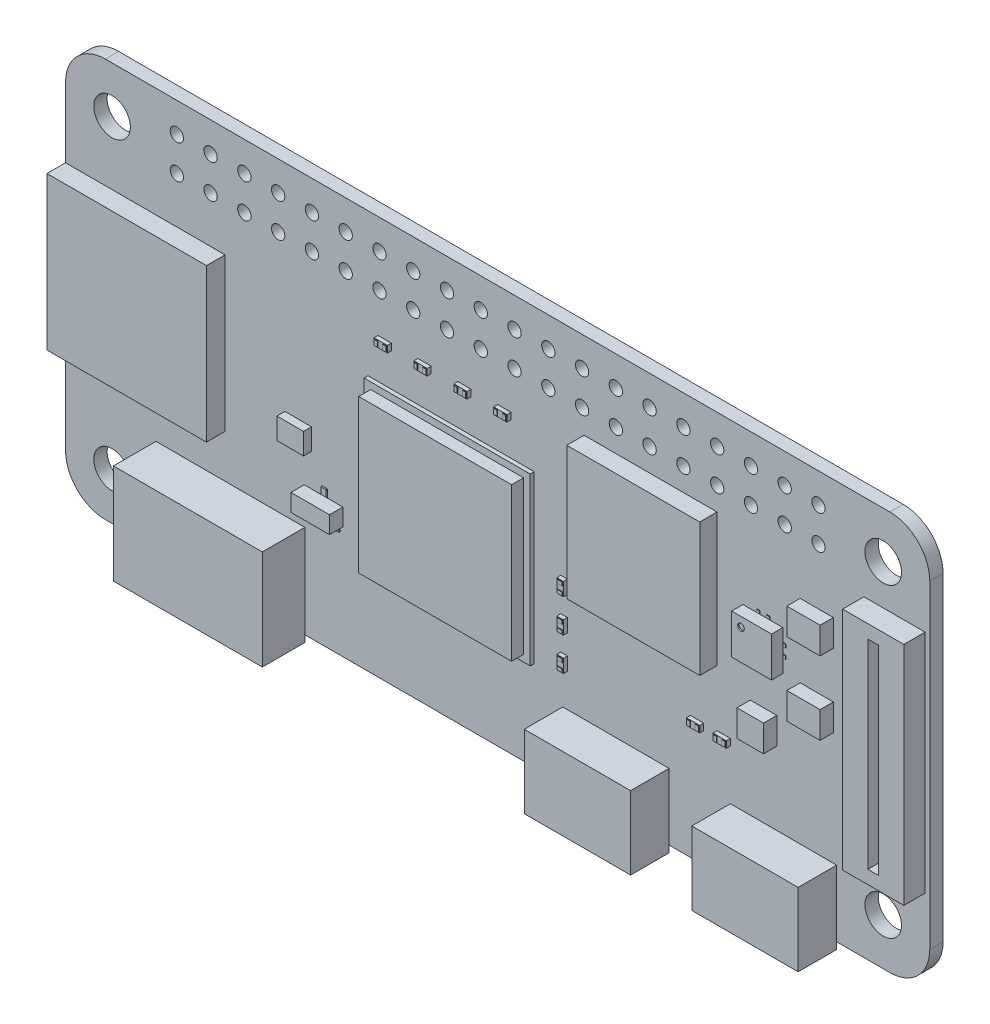
from build123d import *

# Parameters (mm, degrees)
PCB_DEPTH       = 1
SKETCH2_W       = 0.25
SKETCH2_H       = 0.3
SKETCH2_W_2     = 0.3
SKETCH2_H_2     = 0.25
SMD_ADD00_DEPTH = 0.05
SKETCH3_W       = 0.4
SKETCH3_H       = 0.7
SMD_ADD01_DEPTH = 0.1
SKETCH4_W       = 12.5
SKETCH4_H       = 12.5
SKETCH4_W_2     = 0.5
SKETCH4_H_2     = 1
SKETCH4_W_3     = 1
SKETCH4_H_3     = 0.5
SMD_ADD02_DEPTH = 0.3
SKETCH5_W       = 2
SKETCH5_H       = 1.6
SMD_ADD03_DEPTH = 0.6
SKETCH6_W       = 2.5
SKETCH6_H       = 2
SKETCH6_W_2     = 2
SMD_ADD04_DEPTH = 1
SKETCH7_W       = 10
SKETCH7_H       = 10
SMD_ADD05_DEPTH = 1.3
SKETCH8_W       = 12
SKETCH8_H       = 11.5
SMD_ADD06_DEPTH = 1.4
SKETCH9_W       = 4.6
SKETCH9_H       = 17
SMD_ADD07_DEPTH = 1.6
SKETCH10_W      = 8
SKETCH10_H      = 5.5
SMD_ADD08_DEPTH = 2.9
SKETCH11_W      = 11.2
SKETCH11_H      = 7.5
SMD_ADD09_DEPTH = 3.2
SKETCH12_W      = 3
SKETCH12_H      = 3
SMD_ADD10_DEPTH = 0.85
SKETCH13_W      = 2.9
SKETCH13_H      = 1.3
SMD_ADD11_DEPTH = 1
SKETCH14_W      = 0.4
SKETCH14_H      = 0.25
SKETCH14_W_2    = 0.25
SKETCH14_H_2    = 0.4
SMD_ADD12_DEPTH = 0.05
SKETCH15_W      = 11.5
SKETCH15_H      = 11.5
SMD_ADD13_DEPTH = 0.9
SKETCH16_W      = 5.5
SKETCH16_H      = 2
SMD_CUT00_DEPTH = 7
SKETCH17_R      = 0.25
SMD_CUT01_DEPTH = 0.1
SKETCH18_W      = 0.8
SKETCH18_H      = 15
SMD_CUT02_DEPTH = 1.1
SKETCH19_R      = 1.375
SKETCH19_R_2    = 0.5
HOLES_DEPTH     = 1


with BuildPart() as part:
    # Sketch1 → PCB (new body)
    with BuildSketch(Plane.XY):
        with BuildLine():
            Line((3, 0), (62, 0))
            ThreePointArc((62, 0), (64.121320344, 0.878679656), (65, 3))
            Line((65, 3), (65, 27))
            ThreePointArc((65, 27), (64.121320344, 29.121320344), (62, 30))
            Line((62, 30), (3, 30))
            ThreePointArc((3, 30), (0.878679656, 29.121320344), (0, 27))
            Line((0, 27), (0, 3))
            ThreePointArc((0, 3), (0.878679656, 0.878679656), (3, 0))
        make_face()
    extrude(amount=PCB_DEPTH)

    # Sketch2 → SMD_add00 (add)
    with BuildSketch(Plane.XY.offset(1)):
        with Locations((52.125, 15.45)):
            Rectangle(SKETCH2_W, SKETCH2_H)
        with Locations((50.95, 16.625)):
            Rectangle(SKETCH2_W_2, SKETCH2_H_2)
        with Locations((52.125, 18.55)):
            Rectangle(SKETCH2_W, SKETCH2_H)
        with Locations((54.05, 16.625)):
            Rectangle(SKETCH2_W_2, SKETCH2_H_2)
        with Locations((52.875, 15.45)):
            Rectangle(SKETCH2_W, SKETCH2_H)
        with Locations((50.95, 17.375)):
            Rectangle(SKETCH2_W_2, SKETCH2_H_2)
        with Locations((52.875, 18.55)):
            Rectangle(SKETCH2_W, SKETCH2_H)
        with Locations((54.05, 17.375)):
            Rectangle(SKETCH2_W_2, SKETCH2_H_2)
    extrude(amount=SMD_ADD00_DEPTH)

    # Sketch3 → SMD_add01 (add)
    with BuildSketch(Plane.XY.offset(1)):
        with Locations((18.55, 8.4)):
            Rectangle(SKETCH3_W, SKETCH3_H)
        with Locations((20.45, 8.4)):
            Rectangle(SKETCH3_W, SKETCH3_H)
        with Locations((19.5, 10)):
            Rectangle(SKETCH3_W, SKETCH3_H)
    extrude(amount=SMD_ADD01_DEPTH)

    # Sketch4 → SMD_add02 (add)
    with BuildSketch(Plane.XY.offset(1)):
        with Locations((29, 13)):
            Rectangle(SKETCH4_W, SKETCH4_H)
        with Locations((37.5, 8)):
            Rectangle(SKETCH4_W_2, SKETCH4_H_2)
        with Locations((37.5, 10.5)):
            Rectangle(SKETCH4_W_2, SKETCH4_H_2)
        with Locations((37.5, 13)):
            Rectangle(SKETCH4_W_2, SKETCH4_H_2)
        with Locations((47.5, 9)):
            Rectangle(SKETCH4_W_3, SKETCH4_H_3)
        with Locations((49.5, 9)):
            Rectangle(SKETCH4_W_3, SKETCH4_H_3)
        with Locations((24, 22)):
            Rectangle(SKETCH4_W_3, SKETCH4_H_3)
        with Locations((27, 22)):
            Rectangle(SKETCH4_W_3, SKETCH4_H_3)
        with Locations((30, 22)):
            Rectangle(SKETCH4_W_3, SKETCH4_H_3)
        with Locations((33, 22)):
            Rectangle(SKETCH4_W_3, SKETCH4_H_3)
    extrude(amount=SMD_ADD02_DEPTH)

    # Sketch5 → SMD_add03 (add)
    with BuildSketch(Plane.XY.offset(1)):
        with Locations((17.5, 13)):
            Rectangle(SKETCH5_W, SKETCH5_H)
    extrude(amount=SMD_ADD03_DEPTH)

    # Sketch6 → SMD_add04 (add)
    with BuildSketch(Plane.XY.offset(1)):
        with Locations((56.5, 20)):
            Rectangle(SKETCH6_W, SKETCH6_H)
        with Locations((56.5, 14.5)):
            Rectangle(SKETCH6_W, SKETCH6_H)
        with Locations((52.5, 11.5)):
            Rectangle(SKETCH6_W_2, SKETCH6_H)
    extrude(amount=SMD_ADD04_DEPTH)

    # Sketch7 → SMD_add05 (add)
    with BuildSketch(Plane.XY.offset(1)):
        with Locations((44, 18.5)):
            Rectangle(SKETCH7_W, SKETCH7_H)
    extrude(amount=SMD_ADD05_DEPTH)

    # Sketch8 → SMD_add06 (add)
    with BuildSketch(Plane.XY.offset(1)):
        with Locations((6, 16)):
            Rectangle(SKETCH8_W, SKETCH8_H)
    extrude(amount=SMD_ADD06_DEPTH)

    # Sketch9 → SMD_add07 (add)
    with BuildSketch(Plane.XY.offset(1)):
        with Locations((62.35, 15)):
            Rectangle(SKETCH9_W, SKETCH9_H)
    extrude(amount=SMD_ADD07_DEPTH)

    # Sketch10 → SMD_add08 (add)
    with BuildSketch(Plane.XY.offset(1)):
        with Locations((41.4, 2.25)):
            Rectangle(SKETCH10_W, SKETCH10_H)
        with Locations((54, 2.25)):
            Rectangle(SKETCH10_W, SKETCH10_H)
    extrude(amount=SMD_ADD08_DEPTH)

    # Sketch11 → SMD_add09 (add)
    with BuildSketch(Plane.XY.offset(1)):
        with Locations((12.4, 3.25)):
            Rectangle(SKETCH11_W, SKETCH11_H)
    extrude(amount=SMD_ADD09_DEPTH)

    # Sketch12 → SMD_add10 (add)
    with BuildSketch(Plane.XY.offset(1.05)):
        with Locations((52.5, 17)):
            Rectangle(SKETCH12_W, SKETCH12_H)
    extrude(amount=SMD_ADD10_DEPTH)

    # Sketch13 → SMD_add11 (add)
    with BuildSketch(Plane.XY.offset(1.1)):
        with Locations((19.5, 9.2)):
            Rectangle(SKETCH13_W, SKETCH13_H)
    extrude(amount=SMD_ADD11_DEPTH)

    # Sketch14 → SMD_add12 (add)
    with BuildSketch(Plane.XY.offset(1.3)):
        with Locations((37.5, 7.675)):
            Rectangle(SKETCH14_W, SKETCH14_H)
        with Locations((37.5, 8.325)):
            Rectangle(SKETCH14_W, SKETCH14_H)
        with Locations((37.5, 10.175)):
            Rectangle(SKETCH14_W, SKETCH14_H)
        with Locations((37.5, 10.825)):
            Rectangle(SKETCH14_W, SKETCH14_H)
        with Locations((37.5, 12.675)):
            Rectangle(SKETCH14_W, SKETCH14_H)
        with Locations((37.5, 13.325)):
            Rectangle(SKETCH14_W, SKETCH14_H)
        with Locations((47.175, 9)):
            Rectangle(SKETCH14_W_2, SKETCH14_H_2)
        with Locations((47.825, 9)):
            Rectangle(SKETCH14_W_2, SKETCH14_H_2)
        with Locations((49.175, 9)):
            Rectangle(SKETCH14_W_2, SKETCH14_H_2)
        with Locations((49.825, 9)):
            Rectangle(SKETCH14_W_2, SKETCH14_H_2)
        with Locations((23.675, 22)):
            Rectangle(SKETCH14_W_2, SKETCH14_H_2)
        with Locations((24.325, 22)):
            Rectangle(SKETCH14_W_2, SKETCH14_H_2)
        with Locations((26.675, 22)):
            Rectangle(SKETCH14_W_2, SKETCH14_H_2)
        with Locations((27.325, 22)):
            Rectangle(SKETCH14_W_2, SKETCH14_H_2)
        with Locations((29.675, 22)):
            Rectangle(SKETCH14_W_2, SKETCH14_H_2)
        with Locations((30.325, 22)):
            Rectangle(SKETCH14_W_2, SKETCH14_H_2)
        with Locations((32.675, 22)):
            Rectangle(SKETCH14_W_2, SKETCH14_H_2)
        with Locations((33.325, 22)):
            Rectangle(SKETCH14_W_2, SKETCH14_H_2)
    extrude(amount=SMD_ADD12_DEPTH)

    # Sketch15 → SMD_add13 (add)
    with BuildSketch(Plane.XY.offset(1.3)):
        with Locations((29, 13)):
            Rectangle(SKETCH15_W, SKETCH15_H)
    extrude(amount=SMD_ADD13_DEPTH)

    # Sketch16 → SMD_cut00 (cut)
    with BuildSketch(Plane(origin=(0, 6.5, 0), x_dir=(1, 0, 0), z_dir=(0, 1, 0))):
        with Locations((12.4, -2.6)):
            Rectangle(SKETCH16_W, SKETCH16_H)
    extrude(amount=-SMD_CUT00_DEPTH, mode=Mode.SUBTRACT)

    # Sketch17 → SMD_cut01 (cut)
    with BuildSketch(Plane.XY.offset(1.9)):
        with Locations((51.7, 17.8)):
            Circle(SKETCH17_R)
    extrude(amount=-SMD_CUT01_DEPTH, mode=Mode.SUBTRACT)

    # Sketch18 → SMD_cut02 (cut)
    with BuildSketch(Plane.XY.offset(2.6)):
        with Locations((62.35, 15)):
            Rectangle(SKETCH18_W, SKETCH18_H)
    extrude(amount=-SMD_CUT02_DEPTH, mode=Mode.SUBTRACT)

    # Sketch19 → Holes (cut)
    with BuildSketch(Plane.XY.offset(1)):
        with Locations((3.5, 3.5)):
            Circle(SKETCH19_R)
        with Locations((61.5, 3.5)):
            Circle(SKETCH19_R)
        with Locations((3.5, 26.5)):
            Circle(SKETCH19_R)
        with Locations((61.5, 26.5)):
            Circle(SKETCH19_R)
        with Locations((8.37, 25.23)):
            Circle(SKETCH19_R_2)
        with Locations((8.37, 27.77)):
            Circle(SKETCH19_R_2)
        with Locations((10.91, 25.23)):
            Circle(SKETCH19_R_2)
        with Locations((10.91, 27.77)):
            Circle(SKETCH19_R_2)
        with Locations((13.45, 25.23)):
            Circle(SKETCH19_R_2)
        with Locations((13.45, 27.77)):
            Circle(SKETCH19_R_2)
        with Locations((15.99, 25.23)):
            Circle(SKETCH19_R_2)
        with Locations((15.99, 27.77)):
            Circle(SKETCH19_R_2)
        with Locations((18.53, 25.23)):
            Circle(SKETCH19_R_2)
        with Locations((18.53, 27.77)):
            Circle(SKETCH19_R_2)
        with Locations((21.07, 25.23)):
            Circle(SKETCH19_R_2)
        with Locations((21.07, 27.77)):
            Circle(SKETCH19_R_2)
        with Locations((23.61, 25.23)):
            Circle(SKETCH19_R_2)
        with Locations((23.61, 27.77)):
            Circle(SKETCH19_R_2)
        with Locations((26.15, 25.23)):
            Circle(SKETCH19_R_2)
        with Locations((26.15, 27.77)):
            Circle(SKETCH19_R_2)
        with Locations((28.69, 25.23)):
            Circle(SKETCH19_R_2)
        with Locations((28.69, 27.77)):
            Circle(SKETCH19_R_2)
        with Locations((31.23, 25.23)):
            Circle(SKETCH19_R_2)
        with Locations((31.23, 27.77)):
            Circle(SKETCH19_R_2)
        with Locations((33.77, 25.23)):
            Circle(SKETCH19_R_2)
        with Locations((33.77, 27.77)):
            Circle(SKETCH19_R_2)
        with Locations((36.31, 25.23)):
            Circle(SKETCH19_R_2)
        with Locations((36.31, 27.77)):
            Circle(SKETCH19_R_2)
        with Locations((38.85, 25.23)):
            Circle(SKETCH19_R_2)
        with Locations((38.85, 27.77)):
            Circle(SKETCH19_R_2)
        with Locations((41.39, 25.23)):
            Circle(SKETCH19_R_2)
        with Locations((41.39, 27.77)):
            Circle(SKETCH19_R_2)
        with Locations((43.93, 25.23)):
            Circle(SKETCH19_R_2)
        with Locations((43.93, 27.77)):
            Circle(SKETCH19_R_2)
        with Locations((46.47, 25.23)):
            Circle(SKETCH19_R_2)
        with Locations((46.47, 27.77)):
            Circle(SKETCH19_R_2)
        with Locations((49.01, 25.23)):
            Circle(SKETCH19_R_2)
        with Locations((49.01, 27.77)):
            Circle(SKETCH19_R_2)
        with Locations((51.55, 25.23)):
            Circle(SKETCH19_R_2)
        with Locations((51.55, 27.77)):
            Circle(SKETCH19_R_2)
        with Locations((54.09, 25.23)):
            Circle(SKETCH19_R_2)
        with Locations((54.09, 27.77)):
            Circle(SKETCH19_R_2)
        with Locations((56.63, 25.23)):
            Circle(SKETCH19_R_2)
        with Locations((56.63, 27.77)):
            Circle(SKETCH19_R_2)
    extrude(amount=-HOLES_DEPTH, mode=Mode.SUBTRACT)


solid = part.part
